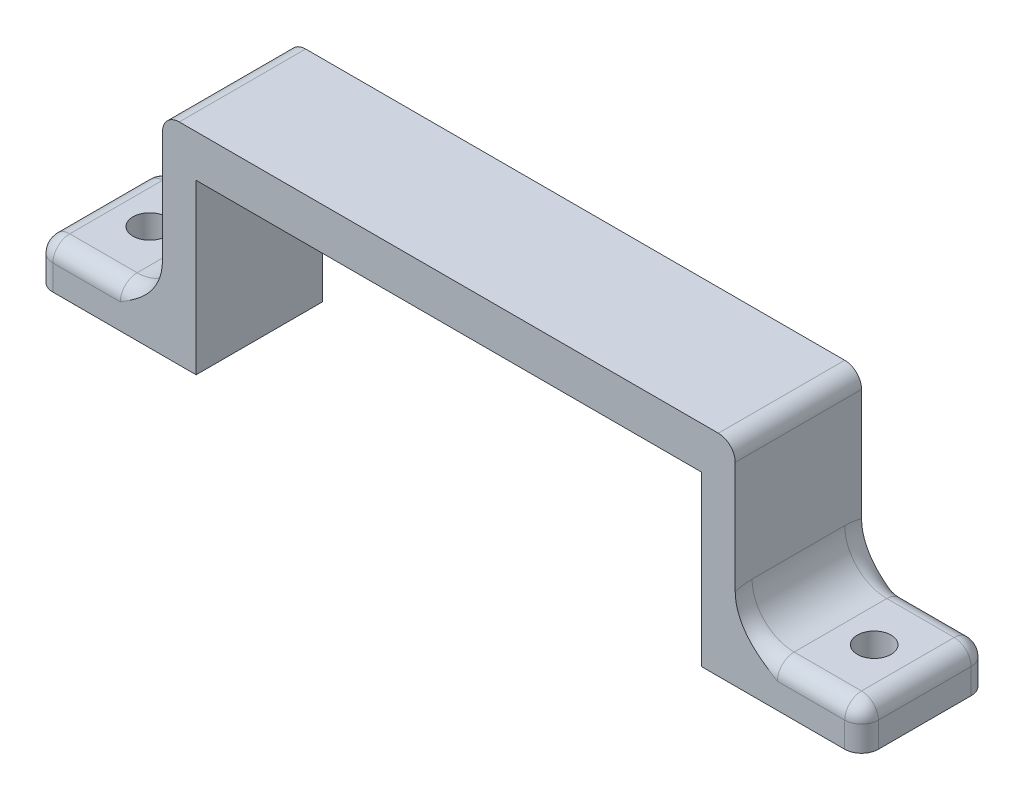
from build123d import *

# Parameters (mm, degrees)
SKETCH1_W           = 15
SKETCH1_H           = 15
SKETCH1_W_2         = 4
SKETCH1_W_3         = 60
BOSS_EXTRUDE1_DEPTH = 25
SKETCH1_3_W         = 60
SKETCH1_3_H         = 15
CUT_EXTRUDE1_DEPTH  = 20
CUT_EXTRUDE2_START  = 25
SKETCH1_4_W         = 15
SKETCH1_4_H         = 15
CUT_EXTRUDE2_DEPTH  = 20
FILLET1_R           = 2
FILLET2_R           = 2
FILLET3_R           = 5
CUT_EXTRUDE3_REACH  = 84.861
SKETCH2_R           = 2


with BuildPart() as part:
    # Sketch1 → Boss-Extrude1 (new body)
    with BuildSketch(Plane(origin=(0, 0, 0), x_dir=(1, 0, 0), z_dir=(0, 1, 0))):
        with Locations((-71.5, -7.5)):
            Rectangle(SKETCH1_W, SKETCH1_H)
        with Locations((-62, -7.5)):
            Rectangle(SKETCH1_W_2, SKETCH1_H)
        with Locations((-30, -7.5)):
            Rectangle(SKETCH1_W_3, SKETCH1_H)
        with Locations((2, -7.5)):
            Rectangle(SKETCH1_W_2, SKETCH1_H)
        with Locations((11.5, -7.5)):
            Rectangle(SKETCH1_W, SKETCH1_H)
    extrude(amount=BOSS_EXTRUDE1_DEPTH)

    # Sketch1<3> → Cut-Extrude1 (cut)
    with BuildSketch(Plane(origin=(0, 0, 0), x_dir=(1, 0, 0), z_dir=(0, 1, 0))):
        with Locations((-30, -7.5)):
            Rectangle(SKETCH1_3_W, SKETCH1_3_H)
    extrude(amount=CUT_EXTRUDE1_DEPTH, mode=Mode.SUBTRACT)

    # Sketch1<4> → Cut-Extrude2 (cut)
    with BuildSketch(Plane(origin=(0, 0, 0), x_dir=(1, 0, 0), z_dir=(0, 1, 0)).offset(CUT_EXTRUDE2_START)):
        with Locations((-71.5, -7.5)):
            Rectangle(SKETCH1_4_W, SKETCH1_4_H)
        with Locations((11.5, -7.5)):
            Rectangle(SKETCH1_4_W, SKETCH1_4_H)
    extrude(amount=-CUT_EXTRUDE2_DEPTH, mode=Mode.SUBTRACT)

    # Fillet1
    fillet1_edges = [part.edges().sort_by_distance(p)[0] for p in [
        (19, 2.5, 0),
        (19, 2.5, 15),
        (-79, 2.5, 15),
        (-79, 2.5, 0),
        (-64, 25, 7.5),
        (4, 25, 7.5),
    ]]
    fillet(fillet1_edges, radius=FILLET1_R)

    # Fillet2
    fillet2_edges = [part.edges().sort_by_distance(p)[0] for p in [
        (-70.5, 5, 0),
        (-70.5, 5, 15),
        (10.5, 5, 15),
        (10.5, 5, 0),
        (19, 5, 7.5),
        (18.414213562, 5, 14.414213562),
        (18.414213562, 5, 0.585786438),
        (-79, 5, 7.5),
        (-78.414213562, 5, 14.414213562),
        (-78.414213562, 5, 0.585786438),
    ]]
    fillet(fillet2_edges, radius=FILLET2_R)

    # Fillet3
    # the kernel refuses this fillet: 5 mm, written as the material it adds along each edge
    with BuildSketch(Plane(origin=(-64, 5, 13), x_dir=(-1, 0, 0), z_dir=(0, 0, -1))) as fillet3_piece_1:
        with BuildLine():
            CenterArc((FILLET3_R, FILLET3_R), FILLET3_R, 180, 90)
            Line((0, FILLET3_R), (0, 0))
            Line((0, 0), (FILLET3_R, 0))
        make_face()
    extrude(amount=11)
    with BuildSketch(Plane(origin=(4, 5, 13), x_dir=(1, 0, 0), z_dir=(0, 0, -1))) as fillet3_piece_2:
        with BuildLine():
            CenterArc((FILLET3_R, -FILLET3_R), FILLET3_R, 90, 90)
            Line((0, -FILLET3_R), (0, 0))
            Line((0, 0), (FILLET3_R, 0))
        make_face()
    extrude(amount=11)
    with BuildSketch(Plane(origin=(-64, 3, 13), x_dir=(0, 0.9999802608561372, -0.00628314396555929), z_dir=(0, 0.00628314396555929, 0.9999802608561372))) as fillet3_piece_3_section:
        with BuildLine():
            CenterArc((-2 - FILLET3_R, FILLET3_R), FILLET3_R, 270, 90)
            Line((-2 - FILLET3_R, 0), (-2, 0))
            Line((-2, 0), (-2, FILLET3_R))
        make_face()
    fillet3_piece_3 = revolve(axis=Axis((-64, 3, 13), (-1, 0, 0)), revolution_arc=359.64, mode=Mode.PRIVATE)
    fillet3_piece_3 = split(fillet3_piece_3, bisect_by=Plane(origin=(-65.84257052, 4.524977571, 15), z_dir=(0, 0, -1)), keep=Keep.TOP, mode=Mode.PRIVATE)
    fillet3_piece_3 = split(fillet3_piece_3, bisect_by=Plane(origin=(-65.84257052, 0, 14.524977571), z_dir=(0, 1, 0)), keep=Keep.TOP, mode=Mode.PRIVATE)
    add(fillet3_piece_3)
    with BuildSketch(Plane(origin=(4, 3, 13), x_dir=(0, 1, 0), z_dir=(0, 0, -1))) as fillet3_piece_4_section:
        with BuildLine():
            CenterArc((2 + FILLET3_R, FILLET3_R), FILLET3_R, 180, 90)
            Line((2 + FILLET3_R, 0), (2, 0))
            Line((2, 0), (2, FILLET3_R))
        make_face()
    fillet3_piece_4 = revolve(axis=Axis((4, 3, 13), (1, 0, 0)), revolution_arc=359.64, mode=Mode.PRIVATE)
    fillet3_piece_4 = split(fillet3_piece_4, bisect_by=Plane(origin=(5.842570594, 4.524977559, 15), z_dir=(0, 0, -1)), keep=Keep.TOP, mode=Mode.PRIVATE)
    fillet3_piece_4 = split(fillet3_piece_4, bisect_by=Plane(origin=(5.842570594, 0, 14.524977563), z_dir=(0, 1, 0)), keep=Keep.TOP, mode=Mode.PRIVATE)
    add(fillet3_piece_4)
    with BuildSketch(Plane(origin=(-64, 3, 2), x_dir=(0, 0.9999802608561372, 0.006283143965558735), z_dir=(0, 0.006283143965558735, -0.9999802608561372))) as fillet3_piece_5_section:
        with BuildLine():
            CenterArc((-2 - FILLET3_R, -FILLET3_R), FILLET3_R, 0, 90)
            Line((-2 - FILLET3_R, 0), (-2, 0))
            Line((-2, 0), (-2, -FILLET3_R))
        make_face()
    fillet3_piece_5 = revolve(axis=Axis((-64, 3, 2), (1, 0, 0)), revolution_arc=359.64, mode=Mode.PRIVATE)
    fillet3_piece_5 = split(fillet3_piece_5, bisect_by=Plane(origin=(-65.842570484, 4.524977652, 0), z_dir=(0, 0, 1)), keep=Keep.TOP, mode=Mode.PRIVATE)
    fillet3_piece_5 = split(fillet3_piece_5, bisect_by=Plane(origin=(-65.842570484, 0, 0.47502245), z_dir=(0, 1, 0)), keep=Keep.TOP, mode=Mode.PRIVATE)
    add(fillet3_piece_5)
    with BuildSketch(Plane(origin=(4, 3, 2), x_dir=(0, 1, 0), z_dir=(0, 0, 1))) as fillet3_piece_6_section:
        with BuildLine():
            CenterArc((2 + FILLET3_R, -FILLET3_R), FILLET3_R, 90, 90)
            Line((2, -FILLET3_R), (2, 0))
            Line((2, 0), (2 + FILLET3_R, 0))
        make_face()
    fillet3_piece_6 = revolve(axis=Axis((4, 3, 2), (-1, 0, 0)), revolution_arc=359.64, mode=Mode.PRIVATE)
    fillet3_piece_6 = split(fillet3_piece_6, bisect_by=Plane(origin=(4.944030812, 6.137069115, 0), z_dir=(0, 0, 1)), keep=Keep.TOP, mode=Mode.PRIVATE)
    fillet3_piece_6 = split(fillet3_piece_6, bisect_by=Plane(origin=(4.944030812, 0, 1.077199574), z_dir=(0, 1, 0)), keep=Keep.TOP, mode=Mode.PRIVATE)
    add(fillet3_piece_6)

    # Sketch2 → Cut-Extrude3 (cut, up to next)
    with BuildSketch(Plane(origin=(0, 5, 0), x_dir=(1, 0, 0), z_dir=(0, 1, 0)), mode=Mode.PRIVATE) as cut_extrude3_sk1:
        with Locations(Location((13, -7.5, 0), (0, 0, 270))):
            Circle(SKETCH2_R)
    cut_extrude3_tool1 = extrude(cut_extrude3_sk1.sketch, amount=-CUT_EXTRUDE3_REACH, mode=Mode.PRIVATE) & part.part
    # Sketch2 → Cut-Extrude3 (cut, up to next)
    with BuildSketch(Plane(origin=(0, 5, 0), x_dir=(1, 0, 0), z_dir=(0, 1, 0)), mode=Mode.PRIVATE) as cut_extrude3_sk2:
        with Locations(Location((-73, -7.5, 0), (0, 0, 270))):
            Circle(SKETCH2_R)
    cut_extrude3_tool2 = extrude(cut_extrude3_sk2.sketch, amount=-CUT_EXTRUDE3_REACH, mode=Mode.PRIVATE) & part.part
    add(cut_extrude3_tool1.solids().sort_by_distance((13, 5, 7.5))[0], mode=Mode.SUBTRACT)
    add(cut_extrude3_tool2.solids().sort_by_distance((-73, 5, 7.5))[0], mode=Mode.SUBTRACT)


solid = part.part
